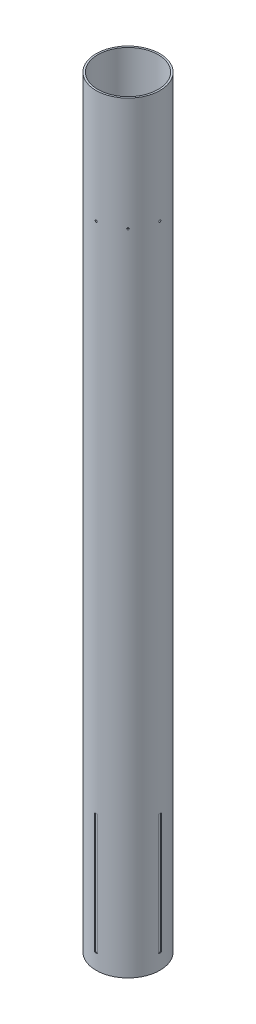
from build123d import *

# Parameters (mm, degrees)
SKETCH1_R               = 53.721
SKETCH1_R_2             = 50.8
TUBE_EXTRUSION_DEPTH    = 1282.7
ENGINE_BLOCK_HOLE_REACH = 1290.312
SKETCH2_R               = 1.6383
CIRPATTERN1_COUNT       = 8
SKETCH3_W               = 5.334
SKETCH3_H               = 203.2
FIN_SLOTS_DEPTH         = 1.27
CIRPATTERN2_COUNT       = 4


with BuildPart() as part:
    # Sketch1 → Tube Extrusion (new body)
    with BuildSketch(Plane(origin=(0, 0, 0), x_dir=(1, 0, 0), z_dir=(0, 1, 0))):
        Circle(SKETCH1_R)
        Circle(SKETCH1_R_2, mode=Mode.SUBTRACT)
    extrude(amount=TUBE_EXTRUSION_DEPTH)

    # Sketch2 → Engine Block Hole (cut, up to next)
    with BuildSketch(Plane.XY.offset(53.721), mode=Mode.PRIVATE) as engine_block_hole_sk1:
        with Locations((0, 1092.2)):
            Circle(SKETCH2_R)
    engine_block_hole_tool1 = extrude(engine_block_hole_sk1.sketch, amount=-ENGINE_BLOCK_HOLE_REACH, mode=Mode.PRIVATE) & part.part
    engine_block_hole = engine_block_hole_tool1.solids().sort_by_distance((0, 1092.2, 53.721))[0]
    add(engine_block_hole, mode=Mode.SUBTRACT)

    # CirPattern1: Engine Block Hole ×8 about axis
    cirpattern1_axis = Axis((0, 1282.7, 0), (0, -1, 0))
    for i in range(1, CIRPATTERN1_COUNT):
        add(engine_block_hole.rotate(cirpattern1_axis, i * 360 / CIRPATTERN1_COUNT), mode=Mode.SUBTRACT)

    # Sketch3 → Fin Slots (cut)
    with BuildSketch(Plane.XY.offset(53.721)):
        with Locations((0, 127)):
            Rectangle(SKETCH3_W, SKETCH3_H)
    fin_slots = extrude(amount=-FIN_SLOTS_DEPTH, mode=Mode.SUBTRACT)

    # CirPattern2: Fin Slots ×4 about axis
    cirpattern2_axis = Axis((0, 1282.7, 0), (0, -1, 0))
    for i in range(1, CIRPATTERN2_COUNT):
        add(fin_slots.rotate(cirpattern2_axis, i * 360 / CIRPATTERN2_COUNT), mode=Mode.SUBTRACT)


solid = part.part
